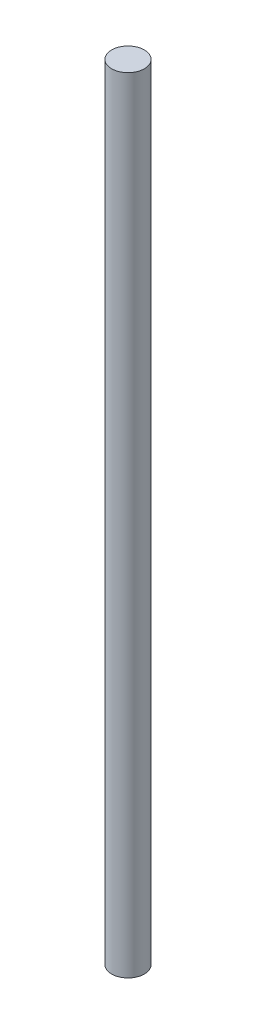
from build123d import *

# Parameters (mm, degrees)
SKETCH1_R           = 6.35
BOSS_EXTRUDE1_DEPTH = 304.8


with BuildPart() as part:
    # Sketch1 → Boss-Extrude1 (new body)
    with BuildSketch(Plane(origin=(0, 0, 0), x_dir=(1, 0, 0), z_dir=(0, 1, 0))):
        Circle(SKETCH1_R)
    extrude(amount=BOSS_EXTRUDE1_DEPTH)


solid = part.part
